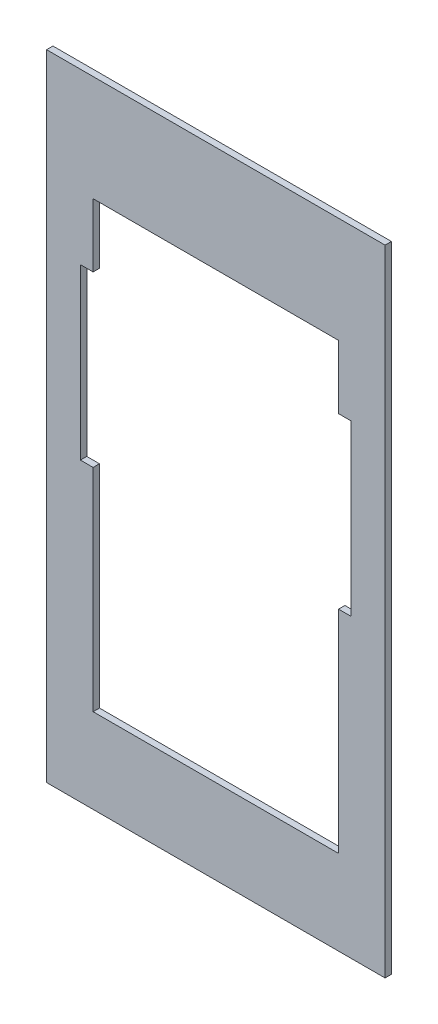
from build123d import *

# Parameters (mm, degrees)
SKETCH1_W           = 80
SKETCH1_H           = 150
BOSS_EXTRUDE1_DEPTH = 1.5


with BuildPart() as part:
    # Sketch1 → Boss-Extrude1 (new body)
    with BuildSketch(Plane.XY):
        Rectangle(SKETCH1_W, SKETCH1_H)
        Polygon((29, 50), (-29, 50), (-29, 35), (-32, 35), (-32, -5), (-29, -5), (-29, -55), (29, -55), (29, -5), (32, -5), (32, 35), (29, 35), align=None, mode=Mode.SUBTRACT)
    extrude(amount=BOSS_EXTRUDE1_DEPTH)


solid = part.part
